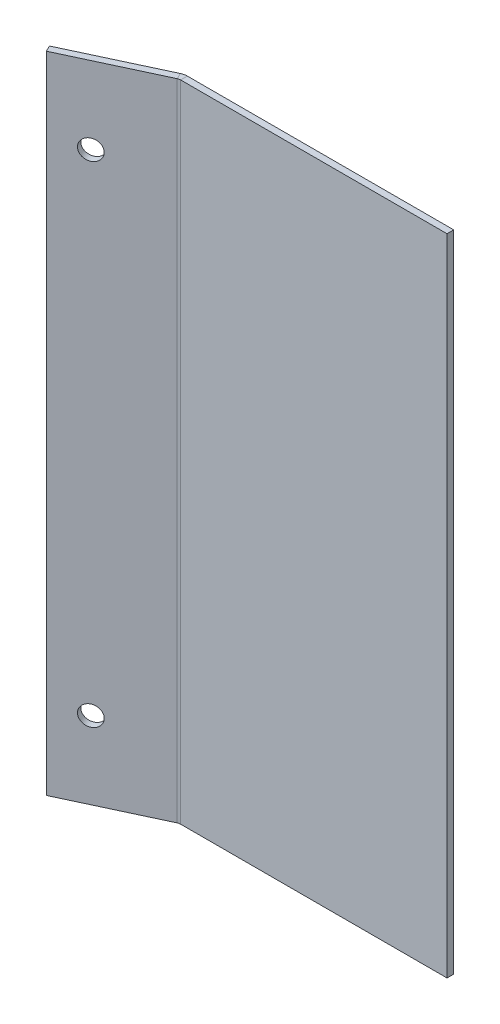
from build123d import *

# Parameters (mm, degrees)
IZIM1_W                     = 40
IZIM1_H                     = 96
IZIM1_W_2                   = 15
IZIM1_R                     = 1.5
Y_KSEKLIK_EKSTR_ZYON2_DEPTH = 1
IZGIDEN_START               = 43.181135212
IZGIDEN_B_KME3_OUTLINE_R    = 1.5
IZGIDEN_B_KME3_DEPTH        = 3.071295426
IZGIDEN_START_2             = -15.757423971
IZGIDEN_B_KME3_2_DEPTH      = 96
IZGIDEN_B_KME3_3_DEPTH      = 96
IZGIDEN_START_3             = 48
IZGIDEN_B_KME3_4_OUTLINE_R  = 1.5
IZGIDEN_B_KME3_4_DEPTH      = 2.471326215


with BuildPart() as part:
    # Çizim1 → Yükseklik-Ekstrüzyon2 (new body)
    # profile 1 of 2: a face of its own
    with BuildSketch(Plane.XY):
        with Locations((137.175270501, 32.242576029)):
            Rectangle(IZIM1_W, IZIM1_H)
    # profile 2 of 2: a face of its own
    with BuildSketch(Plane.XY):
        with Locations((109.675270501, 32.242576029)):
            Rectangle(IZIM1_W_2, IZIM1_H)
        with Locations((107.175270501, -4.257423971)):
            Circle(IZIM1_R, mode=Mode.SUBTRACT)
        with Locations((107.175270501, 68.742576029)):
            Circle(IZIM1_R, mode=Mode.SUBTRACT)
    extrude(amount=Y_KSEKLIK_EKSTR_ZYON2_DEPTH)

    # Çizgiden Bükme3: read off the stored shape, not the designer's step
    # Çizgiden Bükme3 outline → Çizgiden Bükme3 (cut)
    with BuildSketch(Plane(origin=(0, 0, 0), x_dir=(0.9063077870366497, 0, -0.42261826174069983), z_dir=(0.4226182617406999, 0, 0.9063077870366498)).offset(IZGIDEN_START)):
        with Locations((95.975461344, -4.257423971)):
            Circle(IZGIDEN_B_KME3_OUTLINE_R)
        with Locations((95.975461344, 68.742576029)):
            Circle(IZGIDEN_B_KME3_OUTLINE_R)
    extrude(amount=IZGIDEN_B_KME3_DEPTH, mode=Mode.SUBTRACT)

    # izgiden B_kme3 2 outline → izgiden B_kme3 2 (cut)
    with BuildSketch(Plane(origin=(0, 0, 0), x_dir=(1, 0, 0), z_dir=(0, 1, 0)).offset(IZGIDEN_START_2)):
        with BuildLine():
            Line((102.175270501, -1), (114.91462349, -1))
            Line((114.91462349, -1), (116.657283212, -0.187384426))
            ThreePointArc((116.657283212, -0.187384426), (117.069640507, -0.047407986), (117.502519735, 0))
            Line((117.502519735, 0), (102.175270501, 0))
            Line((102.175270501, 0), (102.175270501, -1))
        make_face()
    extrude(amount=IZGIDEN_B_KME3_2_DEPTH, mode=Mode.SUBTRACT)

    # izgiden B_kme3 3 outline → izgiden B_kme3 3 (add)
    with BuildSketch(Plane(origin=(0, 0, 0), x_dir=(1, 0, 0), z_dir=(0, 1, 0)).offset(IZGIDEN_START_2)):
        with BuildLine():
            Line((103.359254936, -6.388356849), (103.781873198, -7.294664636))
            Line((103.781873198, -7.294664636), (117.079901474, -1.093692213))
            ThreePointArc((117.079901474, -1.093692213), (117.286080121, -1.023703993), (117.502519735, -1))
            Line((117.502519735, -1), (114.91462349, -1))
            Line((114.91462349, -1), (103.359254936, -6.388356849))
        make_face()
    extrude(amount=IZGIDEN_B_KME3_3_DEPTH)

    # izgiden B_kme3 4 outline → izgiden B_kme3 4 (cut)
    with BuildSketch(Plane(origin=(0, 0, 0), x_dir=(0.9063077870366497, 0, -0.42261826174069983), z_dir=(0.4226182617406999, 0, 0.9063077870366498)).offset(IZGIDEN_START_3)):
        with Locations((95.975461344, -4.257423971)):
            Circle(IZGIDEN_B_KME3_4_OUTLINE_R)
        with Locations((95.975461344, 68.742576029)):
            Circle(IZGIDEN_B_KME3_4_OUTLINE_R)
    extrude(amount=IZGIDEN_B_KME3_4_DEPTH, mode=Mode.SUBTRACT)


solid = part.part
